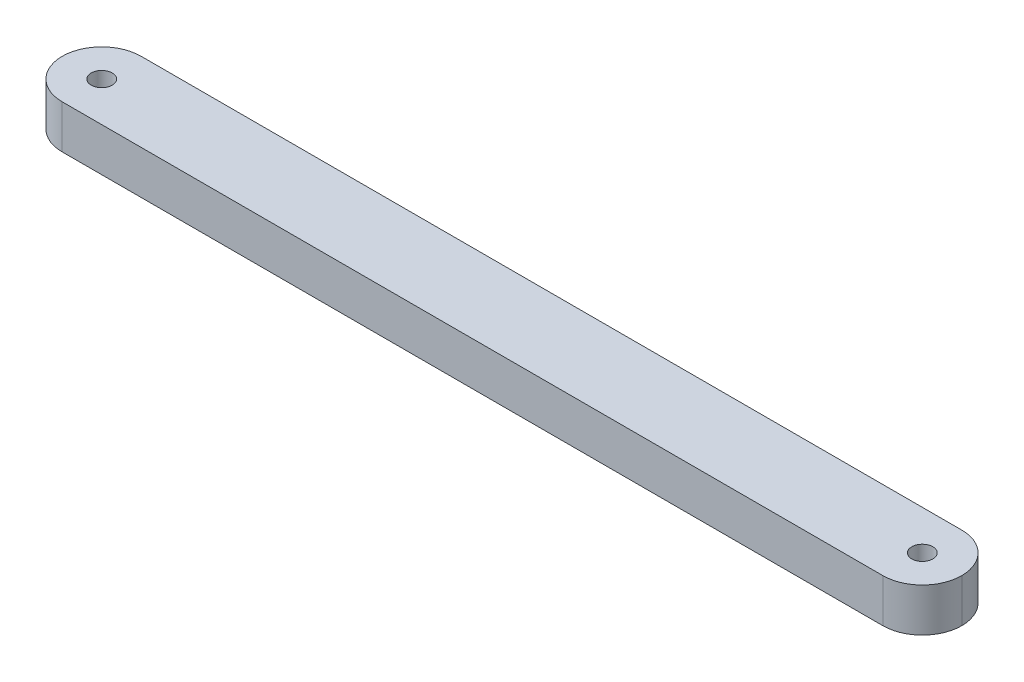
from build123d import *

# Parameters (mm, degrees)
SKETCH1_R           = 1.7
BOSS_EXTRUDE1_DEPTH = 6.985
FILLET1_R           = 6.35


with BuildPart() as part:
    # Sketch1 → Boss-Extrude1 (new body)
    with BuildSketch(Plane(origin=(0, 0, 0), x_dir=(1, 0, 0), z_dir=(0, 1, 0))):
        Polygon((-72.39, 6.35), (-72.39, -6.35), (-6.35, -6.35), (6.35, -6.35), (72.39, -6.35), (72.39, 6.35), (6.35, 6.35), (-6.35, 6.35), align=None)
        with Locations(Location((-66.04, 0, 0), (0, 0, 270))):
            Circle(SKETCH1_R, mode=Mode.SUBTRACT)
        with Locations(Location((66.04, 0, 0), (0, 0, 270))):
            Circle(SKETCH1_R, mode=Mode.SUBTRACT)
    extrude(amount=BOSS_EXTRUDE1_DEPTH)

    # Fillet1
    fillet1_edges = [part.edges().sort_by_distance(p)[0] for p in [
        (72.39, 3.4925, -6.35),
        (-72.39, 3.4925, -6.35),
        (-72.39, 3.4925, 6.35),
        (72.39, 3.4925, 6.35),
    ]]
    fillet(fillet1_edges, radius=FILLET1_R - 0.0001)  # a hair under: the kernel refuses the full size


solid = part.part
